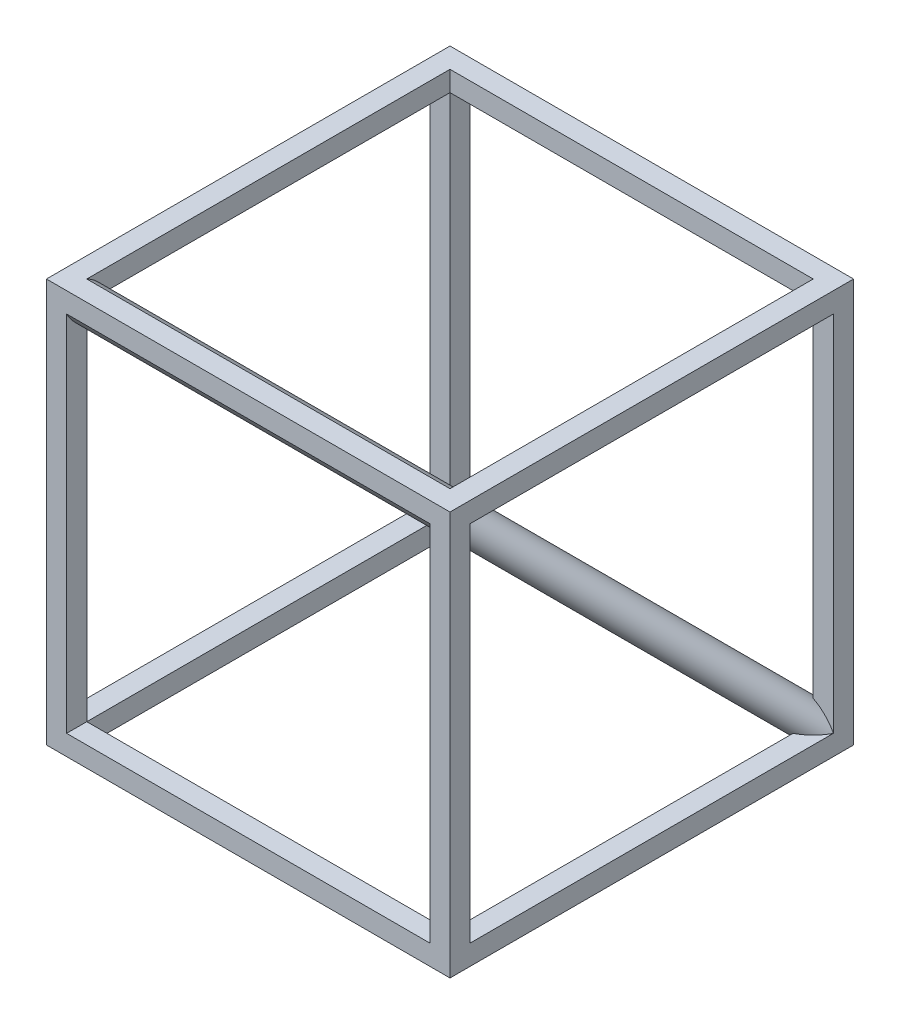
from build123d import *

# Parameters (mm, degrees)
SKETCH1_W           = 10
SKETCH1_H           = 10
BOSS_EXTRUDE1_DEPTH = 10
SHELL2_T            = -0.5
CUT_EXTRUDE1_DEPTH  = 17.748134224
CUT_EXTRUDE2_DEPTH  = 17.748134224
SKETCH5_R           = 0.40824829
BOSS_EXTRUDE6_DEPTH = 16.15
SKETCH9_R           = 0.40824829
BOSS_EXTRUDE5_DEPTH = 16.15


with BuildPart() as part:
    # Sketch1 → Boss-Extrude1 (new body)
    with BuildSketch(Plane(origin=(0, 0, 0), x_dir=(1, 0, 0), z_dir=(0, 1, 0))):
        Rectangle(SKETCH1_W, SKETCH1_H)
    extrude(amount=BOSS_EXTRUDE1_DEPTH)

    # Shell2
    shell2_openings = [part.faces().sort_by_distance(p)[0] for p in [
        (0, 0, 0),
        (0, 10, 0),
    ]]
    offset(amount=SHELL2_T, openings=shell2_openings, kind=Kind.INTERSECTION)

    # 3DSketch1 → Cut-Extrude1 (cut, through all)
    with BuildSketch(Plane(origin=(5, 9.5, 4.5), x_dir=(0, -0.7071067811865475, -0.7071067811865476), z_dir=(1, 0, 0))):
        Polygon((0, 0), (6.363961031, 6.363961031), (12.727922061, 0), (6.363961031, -6.363961031), align=None)
    extrude(amount=-CUT_EXTRUDE1_DEPTH, mode=Mode.SUBTRACT)

    # 3DSketch2 → Cut-Extrude2 (cut, through all)
    with BuildSketch(Plane(origin=(-4.5, 9.5, 5), x_dir=(0.7071067811865476, -0.7071067811865475, 0), z_dir=(0, 0, -1))):
        Polygon((0, 0), (6.363961031, 6.363961031), (12.727922061, 0), (6.363961031, -6.363961031), align=None)
    extrude(amount=CUT_EXTRUDE2_DEPTH, mode=Mode.SUBTRACT)

    # Sketch5 → Boss-Extrude6 (add)
    with BuildSketch(Plane(origin=(-6.333333333, 6.333333333, 6.333333333), x_dir=(0.816496580927726, 0.4082482904638632, 0.4082482904638628), z_dir=(-0.5773502691896257, 0.5773502691896262, 0.5773502691896255))):
        with Locations(Location((2.041241452, 3.535533906, 0), (0, 0, 180))):
            Circle(SKETCH5_R)
    extrude(amount=-BOSS_EXTRUDE6_DEPTH)

    # Sketch9 → Boss-Extrude5 (add)
    with BuildSketch(Plane(origin=(-3, -3, -3), x_dir=(0.8164965809277259, -0.4082482904638629, -0.4082482904638633), z_dir=(0.577350269189626, 0.5773502691896255, 0.577350269189626))):
        with Locations(Location((-2.041241452, 3.535533906, 0), (0, 0, 238.204536501))):
            Circle(SKETCH9_R)
    extrude(amount=BOSS_EXTRUDE5_DEPTH)


solid = part.part
